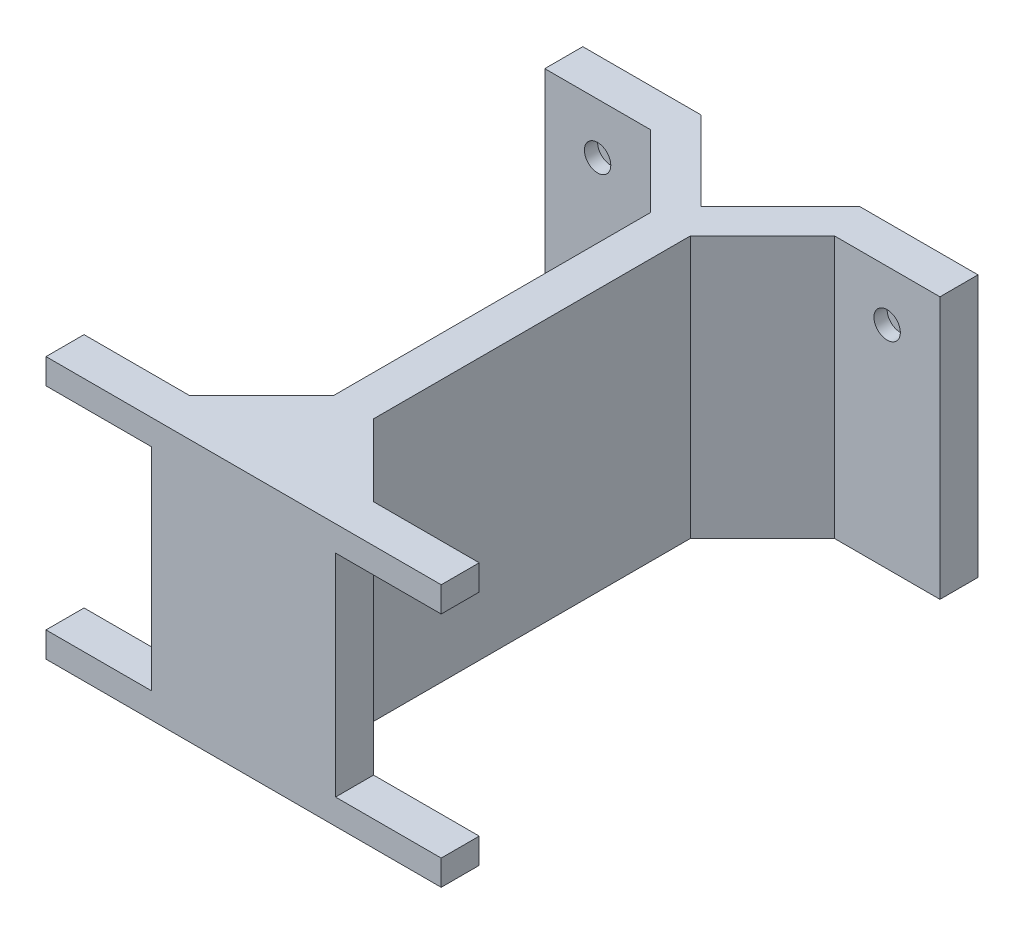
from build123d import *

# Parameters (mm, degrees)
SKETCH2_W           = 74.8
SKETCH2_H           = 49.6
BOSS_EXTRUDE1_DEPTH = 101.6
CUT_EXTRUDE1_DEPTH  = 101.6
CUT_EXTRUDE2_DEPTH  = 101.6
SKETCH5_W           = 20
SKETCH5_H           = 40
CUT_EXTRUDE3_DEPTH  = 10
SKETCH6_W           = 20
SKETCH6_H           = 40
CUT_EXTRUDE4_DEPTH  = 10
SKETCH7_R           = 2.5
CUT_EXTRUDE5_DEPTH  = 2.5
SKETCH8_R           = 2.5
CUT_EXTRUDE6_DEPTH  = 2.5
CUT_EXTRUDE7_DEPTH  = 121.132030177


with BuildPart() as part:
    # Sketch2 → Boss-Extrude1 (new body)
    with BuildSketch(Plane.XY):
        with Locations((-3.207692308, -6.61353022)):
            Rectangle(SKETCH2_W, SKETCH2_H)
    extrude(amount=BOSS_EXTRUDE1_DEPTH)

    # Sketch3 → Cut-Extrude1 (cut)
    with BuildSketch(Plane(origin=(0, 18.18646978, 0), x_dir=(1, 0, 0), z_dir=(0, 1, 0))):
        Polygon((-40.607692308, -7.2), (-20.607692308, -7.2), (-7.007692308, -20.8), (-7.007692308, -80.8), (-20.607692308, -94.4), (-40.607692308, -94.4), align=None)
    extrude(amount=-CUT_EXTRUDE1_DEPTH, mode=Mode.SUBTRACT)

    # Sketch4 → Cut-Extrude2 (cut)
    with BuildSketch(Plane(origin=(0, 18.18646978, 0), x_dir=(1, 0, 0), z_dir=(0, 1, 0))):
        Polygon((34.192307692, -94.4), (14.192307692, -94.4), (0.592307692, -80.8), (0.592307692, -20.8), (14.192307692, -7.2), (34.192307692, -7.2), align=None)
    extrude(amount=-CUT_EXTRUDE2_DEPTH, mode=Mode.SUBTRACT)

    # Sketch5 → Cut-Extrude3 (cut)
    with BuildSketch(Plane.XY.offset(101.6)):
        with Locations((24.192307692, -6.61353022)):
            Rectangle(SKETCH5_W, SKETCH5_H)
    extrude(amount=-CUT_EXTRUDE3_DEPTH, mode=Mode.SUBTRACT)

    # Sketch6 → Cut-Extrude4 (cut)
    with BuildSketch(Plane.XY.offset(101.6)):
        with Locations((-30.607692308, -6.61353022)):
            Rectangle(SKETCH6_W, SKETCH6_H)
    extrude(amount=-CUT_EXTRUDE4_DEPTH, mode=Mode.SUBTRACT)

    # Sketch7 → Cut-Extrude5 (cut)
    with BuildSketch(Plane.XY.offset(7.2)):
        with Locations((24.192307692, 8.58646978)):
            Circle(SKETCH7_R)
    extrude(amount=-CUT_EXTRUDE5_DEPTH, mode=Mode.SUBTRACT)

    # Sketch8 → Cut-Extrude6 (cut)
    with BuildSketch(Plane.XY.offset(7.2)):
        with Locations((-30.607692308, 8.58646978)):
            Circle(SKETCH8_R)
    extrude(amount=-CUT_EXTRUDE6_DEPTH, mode=Mode.SUBTRACT)

    # Sketch9 → Cut-Extrude7 (cut, through all)
    with BuildSketch(Plane(origin=(0, 18.18646978, 0), x_dir=(1, 0, 0), z_dir=(0, 1, 0))):
        Polygon((-18.24818848, 0), (-3.207692308, -15.040496172), (11.832803865, 0), align=None)
    extrude(amount=-CUT_EXTRUDE7_DEPTH, mode=Mode.SUBTRACT)


solid = part.part
